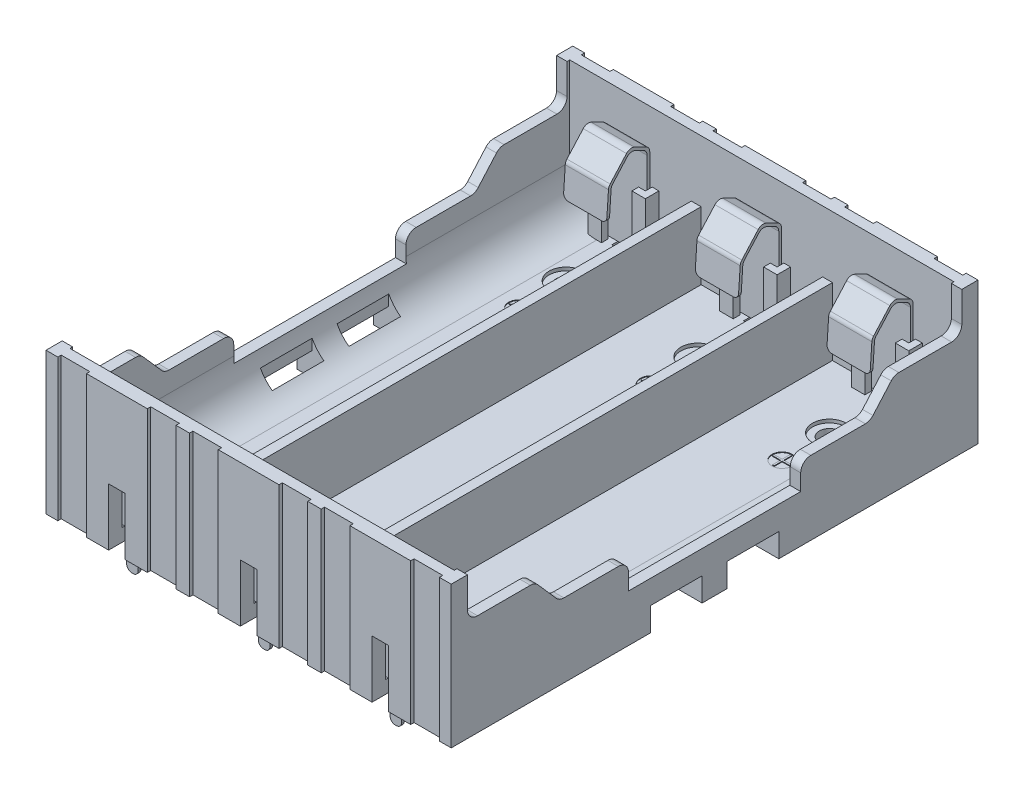
from build123d import *

# Parameters (mm, degrees)
SKETCH_1_W                      = 60
SKETCH_1_H                      = 78
EXTRUDE_5948_DEPTH              = 21
CUT_EXTRUDE_6940_DEPTH          = 54.4976635
SKETCH_3_W                      = 18
SKETCH_3_H                      = 74
CUT_EXTRUDE_7297_DEPTH          = 19.1
FILLET_1_R                      = 6
CUT_EXTRUDE_7699_DEPTH          = 15
CUT_EXTRUDE_7699_DEPTH_BACK     = 15
SKETCH_4_W                      = 74
SKETCH_4_H                      = 18.2
CUT_EXTRUDE_8242_DEPTH          = 15
FILLET_2_R                      = 1.5
FILLET_2_OF_MIRROR_2_R          = 1.5
SKETCH_6_W                      = 2.45
SKETCH_6_H                      = 7
CUT_EXTRUDE_9355_DEPTH          = 8.5
SKETCH_7_W                      = 3.4
SKETCH_7_H                      = 26.05
SKETCH_7_H_2                    = 2.75
CUT_EXTRUDE_9520_DEPTH          = 1
CUT_EXTRUDE_9_REACH             = 55.498
CUT_EXTRUDE_9_DIRECTION_2_REACH = 55.498
CUT_EXTRUDE_START               = -10.8
CUT_EXTRUDE_10_DEPTH            = 26.05
CUT_EXTRUDE_START_2             = 36.85
CUT_EXTRUDE_11_DEPTH            = 26.05
SKETCH_9_W                      = 8
SKETCH_9_H                      = 7.65
CUT_EXTRUDE_11633_DEPTH         = 3.5
SKETCH_10_W                     = 1.75
SKETCH_10_H                     = 7.65
CUT_EXTRUDE_15_DEPTH            = 54.4976635
SKETCH_11_R                     = 1.5
CUT_EXTRUDE_12484_DEPTH         = 54.4976635
EXTRUDE_START                   = -0.3
SKETCH_12_R                     = 2.8
SKETCH_12_R_2                   = 1.5
EXTRUDE_12947_DEPTH             = 0.3
CUT_EXTRUDE_START_3             = -0.5
SKETCH_13_R                     = 2.5
SKETCH_13_R_2                   = 1.5
CUT_EXTRUDE_17_DEPTH            = 0.5
SKETCH_14_R                     = 1.5
SKETCH_14_W                     = 0.25
SKETCH_14_H                     = 2.6
CUT_EXTRUDE_15586_DEPTH         = 0.1
EXTRUDE_16672_DEPTH             = 8.9
EXTRUDE_17213_DEPTH             = 3.2
SKETCH_17_W                     = 1.7
SKETCH_17_H                     = 0.4
EXTRUDE_17647_DEPTH             = 5.5
FILLET_3_R                      = 1
FILLET_4_R                      = 0.75
PATTERN_LINEAR_1_COUNT          = 3
PATTERN_LINEAR_1_PITCH          = 19.5


with BuildPart() as part:
    # Эскиз1 → Extrude 5948 (new body)
    with BuildSketch(Plane(origin=(0, 0, 0), x_dir=(1, 0, 0), z_dir=(0, 1, 0))):
        Rectangle(SKETCH_1_W, SKETCH_1_H)
    extrude(amount=EXTRUDE_5948_DEPTH)

    # Эскиз2 → Cut-Extrude 6940 (cut, through all)
    with BuildSketch(Plane(origin=(0, 0, 0), x_dir=(1, 0, 0), z_dir=(0, 1, 0))):
        Polygon((0, 49.757161848), (0, 39), (4.5, 39), (4.5, 38.5), (8.75, 38.5), (8.75, 39), (10.75, 39), (10.75, 38.5), (15, 38.5), (15, 39), (24, 39), (24, 38.5), (28.25, 38.5), (28.25, 39), (30, 39), (30, 49.757161848), align=None)
        Polygon((-4.5, 38.5), (-4.5, 39), (0, 39), (0, 49.757161848), (-30, 49.757161848), (-30, 39), (-28.25, 39), (-28.25, 38.5), (-24, 38.5), (-24, 39), (-15, 39), (-15, 38.5), (-10.75, 38.5), (-10.75, 39), (-8.75, 39), (-8.75, 38.5), align=None)
    cut_extrude_6940 = extrude(amount=CUT_EXTRUDE_6940_DEPTH, mode=Mode.SUBTRACT)

    # Зеркальное отражение1: Cut-Extrude 6940 across plane
    add(cut_extrude_6940.mirror(Plane.XY), mode=Mode.SUBTRACT)

    # Эскиз3 → Cut-Extrude 7297 (cut)
    with BuildSketch(Plane(origin=(0, 21, 0), x_dir=(1, 0, 0), z_dir=(0, 1, 0))):
        Rectangle(SKETCH_3_W, SKETCH_3_H)
        with Locations((-19.45, 0)):
            Rectangle(SKETCH_3_W, SKETCH_3_H)
        with Locations((19.45, 0)):
            Rectangle(SKETCH_3_W, SKETCH_3_H)
    extrude(amount=-CUT_EXTRUDE_7297_DEPTH, mode=Mode.SUBTRACT)

    # Скругление1
    fillet_1_edges = [part.edges().sort_by_distance(p)[0] for p in [
        (28.45, 1.9, 0),
        (-28.45, 1.9, 0),
    ]]
    fillet(fillet_1_edges, radius=FILLET_1_R)

    # Эскиз4 → Cut-Extrude 7699 (cut, two sides: drawn at the far end of the back side and taken through both)
    with BuildSketch(Plane(origin=(0, 0, 0), x_dir=(0, 0, -1), z_dir=(1, 0, 0)).offset(-CUT_EXTRUDE_7699_DEPTH_BACK)):
        with Locations((0, 21)):
            Rectangle(SKETCH_4_W, SKETCH_4_H)
    extrude(amount=CUT_EXTRUDE_7699_DEPTH + CUT_EXTRUDE_7699_DEPTH_BACK, mode=Mode.SUBTRACT)

    # Эскиз5 → Cut-Extrude 8242 (cut)
    with BuildSketch(Plane(origin=(30, 0, 0), x_dir=(0, 0, -1), z_dir=(1, 0, 0))):
        Polygon((36.6, 21), (-36.6, 21), (-36.6, 15), (-26.6, 15), (-23, 10.9), (-12.75, 10.9), (-12.75, 7), (12.75, 7), (12.75, 10.9), (23, 10.9), (26.6, 15), (36.6, 15), align=None)
    cut_extrude_8242 = extrude(amount=-CUT_EXTRUDE_8242_DEPTH, mode=Mode.SUBTRACT)

    # Скругление2
    fillet_2_edges = [part.edges().sort_by_distance(p)[0] for p in [
        (29.225, 15, -36.6),
        (29.225, 15, -26.6),
        (29.225, 10.9, -23),
        (29.225, 10.9, 12.75),
        (29.225, 10.9, 23),
        (29.225, 15, 26.6),
        (29.225, 15, 36.6),
        (29.225, 10.9, -12.75),
    ]]
    fillet(fillet_2_edges, radius=FILLET_2_R)

    # Зеркальное отражение2: Cut-Extrude 8242 across plane
    add(cut_extrude_8242.mirror(Plane(origin=(0, 0, 0), x_dir=(0, 0, 1), z_dir=(1, 0, 0))), mode=Mode.SUBTRACT)

    # Скругление2 of Зеркальное отражение2
    fillet_2_of_mirror_2_edges = [part.edges().sort_by_distance(p)[0] for p in [
        (-29.225, 15, -36.6),
        (-29.225, 15, -26.6),
        (-29.225, 10.9, -23),
        (-29.225, 10.9, 12.75),
        (-29.225, 10.9, 23),
        (-29.225, 15, 26.6),
        (-29.225, 15, 36.6),
        (-29.225, 10.9, -12.75),
    ]]
    fillet(fillet_2_of_mirror_2_edges, radius=FILLET_2_OF_MIRROR_2_R)

    # Эскиз6 → Cut-Extrude 9355 (cut)
    with BuildSketch(Plane(origin=(0, 0, 0), x_dir=(1, 0, 0), z_dir=(0, 1, 0))):
        with Locations((0, -39)):
            Rectangle(SKETCH_6_W, SKETCH_6_H)
        with Locations((-19.5, -39)):
            Rectangle(SKETCH_6_W, SKETCH_6_H)
        with Locations((19.5, -39)):
            Rectangle(SKETCH_6_W, SKETCH_6_H)
        with Locations((19.5, 39)):
            Rectangle(SKETCH_6_W, SKETCH_6_H)
        with Locations((-19.5, 39)):
            Rectangle(SKETCH_6_W, SKETCH_6_H)
        with Locations((0, 39)):
            Rectangle(SKETCH_6_W, SKETCH_6_H)
    extrude(amount=CUT_EXTRUDE_9355_DEPTH, mode=Mode.SUBTRACT)

    # Эскиз7 → Cut-Extrude 9520 (cut)
    with BuildSketch(Plane(origin=(0, 0, 0), x_dir=(1, 0, 0), z_dir=(0, 1, 0))):
        with Locations((-26.025, -23.825)):
            Rectangle(SKETCH_7_W, SKETCH_7_H)
        with Locations((-26.025, 23.825)):
            Rectangle(SKETCH_7_W, SKETCH_7_H)
        with Locations((-26.025, 0)):
            Rectangle(SKETCH_7_W, SKETCH_7_H_2)
        with Locations((26.025, 23.825)):
            Rectangle(SKETCH_7_W, SKETCH_7_H)
        with Locations((26.025, -23.825)):
            Rectangle(SKETCH_7_W, SKETCH_7_H)
        with Locations((26.025, 0)):
            Rectangle(SKETCH_7_W, SKETCH_7_H_2)
    extrude(amount=CUT_EXTRUDE_9520_DEPTH, mode=Mode.SUBTRACT)

    # Вырез-Вытянуть9: up to this face of the body (flat: up to its plane)
    cut_extrude_9_end = Plane(part.part.faces().sort_by_distance((26.025, 0.5, -1.375))[0])
    # Эскиз8 → Вырез-Вытянуть9 (cut, up to the picked face)
    with BuildSketch(Plane.XY, mode=Mode.PRIVATE) as cut_extrude_9_sk1:
        with BuildLine():
            Line((24.325, 1), (27.725, 1))
            Line((27.725, 1), (27.725, 3.072992646))
            ThreePointArc((27.725, 3.072992646), (26.172223748, 1.795028635), (24.325, 1))
        make_face()
    cut_extrude_9_tool1 = split(extrude(cut_extrude_9_sk1.sketch, amount=-CUT_EXTRUDE_9_REACH, mode=Mode.PRIVATE), bisect_by=cut_extrude_9_end, keep=Keep.BOTH, mode=Mode.PRIVATE)
    cut_extrude_9 = cut_extrude_9_tool1.solids().sort_by(Axis((26.729809, 1.623312, 0), (0, 0, -1)))[0]
    add(cut_extrude_9, mode=Mode.SUBTRACT)

    # Вырез-Вытянуть9 direction 2: up to this face of the body (flat: up to its plane)
    cut_extrude_9_direction_2_end = Plane(part.part.faces().sort_by_distance((26.025, 0.5, 1.375))[0])
    # Эскиз8 → Вырез-Вытянуть9 direction 2 (cut, up to the picked face)
    with BuildSketch(Plane.XY, mode=Mode.PRIVATE) as cut_extrude_9_direction_2_sk1:
        with BuildLine():
            Line((24.325, 1), (27.725, 1))
            Line((27.725, 1), (27.725, 3.072992646))
            ThreePointArc((27.725, 3.072992646), (26.172223748, 1.795028635), (24.325, 1))
        make_face()
    cut_extrude_9_direction_2_tool1 = split(extrude(cut_extrude_9_direction_2_sk1.sketch, amount=CUT_EXTRUDE_9_DIRECTION_2_REACH, mode=Mode.PRIVATE), bisect_by=cut_extrude_9_direction_2_end, keep=Keep.BOTH, mode=Mode.PRIVATE)
    cut_extrude_9_direction_2 = cut_extrude_9_direction_2_tool1.solids().sort_by(Axis((26.729809, 1.623312, 0), (0, 0, 1)))[0]
    add(cut_extrude_9_direction_2, mode=Mode.SUBTRACT)

    # Эскиз8<3> → Вырез-Вытянуть10 (cut)
    with BuildSketch(Plane.XY.offset(CUT_EXTRUDE_START)):
        with BuildLine():
            ThreePointArc((24.325, 1), (26.172223748, 1.795028635), (27.725, 3.072992646))
            Line((27.725, 3.072992646), (27.725, 1))
            Line((27.725, 1), (24.325, 1))
        make_face()
    cut_extrude_10 = extrude(amount=-CUT_EXTRUDE_10_DEPTH, mode=Mode.SUBTRACT)

    # Эскиз8<4> → Вырез-Вытянуть11 (cut)
    with BuildSketch(Plane.XY.offset(CUT_EXTRUDE_START_2)):
        with BuildLine():
            Line((24.325, 1), (27.725, 1))
            Line((27.725, 1), (27.725, 3.072992646))
            ThreePointArc((27.725, 3.072992646), (26.172223748, 1.795028635), (24.325, 1))
        make_face()
    cut_extrude_11 = extrude(amount=-CUT_EXTRUDE_11_DEPTH, mode=Mode.SUBTRACT)

    # Зеркальное отражение3: Вырез-Вытянуть9, Вырез-Вытянуть9 direction 2, Вырез-Вытянуть10, Вырез-Вытянуть11 across plane
    add(cut_extrude_9.mirror(Plane(origin=(0, 0, 0), x_dir=(0, 0, 1), z_dir=(1, 0, 0))), mode=Mode.SUBTRACT)
    add(cut_extrude_9_direction_2.mirror(Plane(origin=(0, 0, 0), x_dir=(0, 0, 1), z_dir=(1, 0, 0))), mode=Mode.SUBTRACT)
    add(cut_extrude_10.mirror(Plane(origin=(0, 0, 0), x_dir=(0, 0, 1), z_dir=(1, 0, 0))), mode=Mode.SUBTRACT)
    add(cut_extrude_11.mirror(Plane(origin=(0, 0, 0), x_dir=(0, 0, 1), z_dir=(1, 0, 0))), mode=Mode.SUBTRACT)

    # Эскиз9 → Cut-Extrude 11633 (cut)
    with BuildSketch(Plane(origin=(0, 0, 0), x_dir=(1, 0, 0), z_dir=(0, 1, 0))):
        with Locations((-30, -5.675)):
            Rectangle(SKETCH_9_W, SKETCH_9_H)
        with Locations((-30, 5.675)):
            Rectangle(SKETCH_9_W, SKETCH_9_H)
        with Locations((30, 5.675)):
            Rectangle(SKETCH_9_W, SKETCH_9_H)
        with Locations((30, -5.675)):
            Rectangle(SKETCH_9_W, SKETCH_9_H)
    extrude(amount=CUT_EXTRUDE_11633_DEPTH, mode=Mode.SUBTRACT)

    # Эскиз10 → Вырез-Вытянуть15 (cut, through all)
    with BuildSketch(Plane(origin=(0, 0, 0), x_dir=(1, 0, 0), z_dir=(0, 1, 0))):
        with Locations((26.875, 5.675)):
            Rectangle(SKETCH_10_W, SKETCH_10_H)
        with Locations((-26.875, -5.675)):
            Rectangle(SKETCH_10_W, SKETCH_10_H)
        with Locations((-26.875, 5.675)):
            Rectangle(SKETCH_10_W, SKETCH_10_H)
        with Locations((26.875, -5.675)):
            Rectangle(SKETCH_10_W, SKETCH_10_H)
    extrude(amount=CUT_EXTRUDE_15_DEPTH, mode=Mode.SUBTRACT)

    # Эскиз11 → Cut-Extrude 12484 (cut, through all)
    with BuildSketch(Plane(origin=(0, 0, 0), x_dir=(1, 0, 0), z_dir=(0, 1, 0))):
        with Locations(Location((-19.5, 27.5, 0), (0, 0, 90))):
            Circle(SKETCH_11_R)
        with Locations(Location((0, 27.5, 0), (0, 0, 90))):
            Circle(SKETCH_11_R)
        with Locations(Location((19.5, 27.5, 0), (0, 0, 90))):
            Circle(SKETCH_11_R)
        with Locations(Location((19.5, -27.5, 0), (0, 0, 90))):
            Circle(SKETCH_11_R)
        with Locations(Location((0, -27.5, 0), (0, 0, 90))):
            Circle(SKETCH_11_R)
        with Locations(Location((-19.5, -27.5, 0), (0, 0, 90))):
            Circle(SKETCH_11_R)
    extrude(amount=CUT_EXTRUDE_12484_DEPTH, mode=Mode.SUBTRACT)

    # Эскиз12 → Extrude 12947 (add)
    # profile 1 of 6: a face of its own
    with BuildSketch(Plane(origin=(0, 0, 0), x_dir=(1, 0, 0), z_dir=(0, 1, 0)).offset(EXTRUDE_START)):
        with Locations(Location((-19.5, 27.5, 0), (0, 0, 270))):
            Circle(SKETCH_12_R)
        with Locations(Location((-19.5, 27.5, 0), (0, 0, 90))):
            Circle(SKETCH_12_R_2, mode=Mode.SUBTRACT)
    # profile 2 of 6: a face of its own
    with BuildSketch(Plane(origin=(0, 0, 0), x_dir=(1, 0, 0), z_dir=(0, 1, 0)).offset(EXTRUDE_START)):
        with Locations(Location((0, 27.5, 0), (0, 0, 270))):
            Circle(SKETCH_12_R)
        with Locations(Location((0, 27.5, 0), (0, 0, 90))):
            Circle(SKETCH_12_R_2, mode=Mode.SUBTRACT)
    # profile 3 of 6: a face of its own
    with BuildSketch(Plane(origin=(0, 0, 0), x_dir=(1, 0, 0), z_dir=(0, 1, 0)).offset(EXTRUDE_START)):
        with Locations(Location((19.5, 27.5, 0), (0, 0, 270))):
            Circle(SKETCH_12_R)
        with Locations(Location((19.5, 27.5, 0), (0, 0, 90))):
            Circle(SKETCH_12_R_2, mode=Mode.SUBTRACT)
    # profile 4 of 6: a face of its own
    with BuildSketch(Plane(origin=(0, 0, 0), x_dir=(1, 0, 0), z_dir=(0, 1, 0)).offset(EXTRUDE_START)):
        with Locations(Location((19.5, -27.5, 0), (0, 0, 270))):
            Circle(SKETCH_12_R)
        with Locations(Location((19.5, -27.5, 0), (0, 0, 90))):
            Circle(SKETCH_12_R_2, mode=Mode.SUBTRACT)
    # profile 5 of 6: a face of its own
    with BuildSketch(Plane(origin=(0, 0, 0), x_dir=(1, 0, 0), z_dir=(0, 1, 0)).offset(EXTRUDE_START)):
        with Locations(Location((0, -27.5, 0), (0, 0, 270))):
            Circle(SKETCH_12_R)
        with Locations(Location((0, -27.5, 0), (0, 0, 90))):
            Circle(SKETCH_12_R_2, mode=Mode.SUBTRACT)
    # profile 6 of 6: a face of its own
    with BuildSketch(Plane(origin=(0, 0, 0), x_dir=(1, 0, 0), z_dir=(0, 1, 0)).offset(EXTRUDE_START)):
        with Locations(Location((-19.5, -27.5, 0), (0, 0, 270))):
            Circle(SKETCH_12_R)
        with Locations(Location((-19.5, -27.5, 0), (0, 0, 90))):
            Circle(SKETCH_12_R_2, mode=Mode.SUBTRACT)
    extrude(amount=EXTRUDE_12947_DEPTH)

    # Эскиз13 → Вырез-Вытянуть17 (cut)
    # profile 1 of 6: a face of its own
    with BuildSketch(Plane(origin=(0, 1.9, 0), x_dir=(1, 0, 0), z_dir=(0, 1, 0)).offset(CUT_EXTRUDE_START_3)):
        with Locations(Location((-19.5, -27.5, 0), (0, 0, 270))):
            Circle(SKETCH_13_R)
        with Locations(Location((-19.5, -27.5, 0), (0, 0, 90))):
            Circle(SKETCH_13_R_2, mode=Mode.SUBTRACT)
    # profile 2 of 6: a face of its own
    with BuildSketch(Plane(origin=(0, 1.9, 0), x_dir=(1, 0, 0), z_dir=(0, 1, 0)).offset(CUT_EXTRUDE_START_3)):
        with Locations(Location((0, -27.5, 0), (0, 0, 270))):
            Circle(SKETCH_13_R)
        with Locations(Location((0, -27.5, 0), (0, 0, 90))):
            Circle(SKETCH_13_R_2, mode=Mode.SUBTRACT)
    # profile 3 of 6: a face of its own
    with BuildSketch(Plane(origin=(0, 1.9, 0), x_dir=(1, 0, 0), z_dir=(0, 1, 0)).offset(CUT_EXTRUDE_START_3)):
        with Locations(Location((19.5, 27.5, 0), (0, 0, 270))):
            Circle(SKETCH_13_R)
        with Locations(Location((19.5, 27.5, 0), (0, 0, 90))):
            Circle(SKETCH_13_R_2, mode=Mode.SUBTRACT)
    # profile 4 of 6: a face of its own
    with BuildSketch(Plane(origin=(0, 1.9, 0), x_dir=(1, 0, 0), z_dir=(0, 1, 0)).offset(CUT_EXTRUDE_START_3)):
        with Locations(Location((0, 27.5, 0), (0, 0, 270))):
            Circle(SKETCH_13_R)
        with Locations(Location((0, 27.5, 0), (0, 0, 90))):
            Circle(SKETCH_13_R_2, mode=Mode.SUBTRACT)
    # profile 5 of 6: a face of its own
    with BuildSketch(Plane(origin=(0, 1.9, 0), x_dir=(1, 0, 0), z_dir=(0, 1, 0)).offset(CUT_EXTRUDE_START_3)):
        with Locations(Location((-19.5, 27.5, 0), (0, 0, 270))):
            Circle(SKETCH_13_R)
        with Locations(Location((-19.5, 27.5, 0), (0, 0, 90))):
            Circle(SKETCH_13_R_2, mode=Mode.SUBTRACT)
    # profile 6 of 6: a face of its own
    with BuildSketch(Plane(origin=(0, 1.9, 0), x_dir=(1, 0, 0), z_dir=(0, 1, 0)).offset(CUT_EXTRUDE_START_3)):
        with Locations(Location((19.5, -27.5, 0), (0, 0, 270))):
            Circle(SKETCH_13_R)
        with Locations(Location((19.5, -27.5, 0), (0, 0, 90))):
            Circle(SKETCH_13_R_2, mode=Mode.SUBTRACT)
    extrude(amount=CUT_EXTRUDE_17_DEPTH, mode=Mode.SUBTRACT)

    # Эскиз14 → Cut-Extrude 15586 (cut)
    # profile 1 of 6: a face of its own
    with BuildSketch(Plane(origin=(0, 1.9, 0), x_dir=(1, 0, 0), z_dir=(0, 1, 0))):
        with Locations(Location((-19.5, 20.5, 0), (0, 0, 270))):
            Circle(SKETCH_14_R)
        Polygon((-19.625, 21.8), (-19.375, 21.8), (-19.375, 20.625), (-18.2, 20.625), (-18.2, 20.375), (-19.375, 20.375), (-19.375, 19.2), (-19.625, 19.2), (-19.625, 20.375), (-20.8, 20.375), (-20.8, 20.625), (-19.625, 20.625), align=None, mode=Mode.SUBTRACT)
    # profile 2 of 6: a face of its own
    with BuildSketch(Plane(origin=(0, 1.9, 0), x_dir=(1, 0, 0), z_dir=(0, 1, 0))):
        with Locations(Location((-19.5, -20.5, 0), (0, 0, 270))):
            Circle(SKETCH_14_R)
        with Locations((-19.5, -20.5)):
            Rectangle(SKETCH_14_W, SKETCH_14_H, mode=Mode.SUBTRACT)
    # profile 3 of 6: a face of its own
    with BuildSketch(Plane(origin=(0, 1.9, 0), x_dir=(1, 0, 0), z_dir=(0, 1, 0))):
        with Locations(Location((0, 20.5, 0), (0, 0, 270))):
            Circle(SKETCH_14_R)
        Polygon((-0.125, 21.8), (0.125, 21.8), (0.125, 20.625), (1.3, 20.625), (1.3, 20.375), (0.125, 20.375), (0.125, 19.2), (-0.125, 19.2), (-0.125, 20.375), (-1.3, 20.375), (-1.3, 20.625), (-0.125, 20.625), align=None, mode=Mode.SUBTRACT)
    # profile 4 of 6: a face of its own
    with BuildSketch(Plane(origin=(0, 1.9, 0), x_dir=(1, 0, 0), z_dir=(0, 1, 0))):
        with Locations(Location((0, -20.5, 0), (0, 0, 270))):
            Circle(SKETCH_14_R)
        with Locations((0, -20.5)):
            Rectangle(SKETCH_14_W, SKETCH_14_H, mode=Mode.SUBTRACT)
    # profile 5 of 6: a face of its own
    with BuildSketch(Plane(origin=(0, 1.9, 0), x_dir=(1, 0, 0), z_dir=(0, 1, 0))):
        with Locations(Location((19.5, 20.5, 0), (0, 0, 270))):
            Circle(SKETCH_14_R)
        Polygon((19.375, 21.8), (19.625, 21.8), (19.625, 20.625), (20.8, 20.625), (20.8, 20.375), (19.625, 20.375), (19.625, 19.2), (19.375, 19.2), (19.375, 20.375), (18.2, 20.375), (18.2, 20.625), (19.375, 20.625), align=None, mode=Mode.SUBTRACT)
    # profile 6 of 6: a face of its own
    with BuildSketch(Plane(origin=(0, 1.9, 0), x_dir=(1, 0, 0), z_dir=(0, 1, 0))):
        with Locations(Location((19.5, -20.5, 0), (0, 0, 270))):
            Circle(SKETCH_14_R)
        with Locations((19.5, -20.5)):
            Rectangle(SKETCH_14_W, SKETCH_14_H, mode=Mode.SUBTRACT)
    extrude(amount=-CUT_EXTRUDE_15586_DEPTH, mode=Mode.SUBTRACT)

    # Эскиз15 → Extrude 16672 (add)
    with BuildSketch(Plane(origin=(0, 1.9, 0), x_dir=(1, 0, 0), z_dir=(0, 1, 0))):
        Polygon((-21.75, 35), (-23.75, 35), (-23.75, 37), (-22.75, 37), (-22.75, 36), (-21.75, 36), align=None)
        Polygon((-17.25, 35), (-17.25, 36), (-16.25, 36), (-16.25, 37), (-15.25, 37), (-15.25, 35), align=None)
        Polygon((-2.25, 35), (-4.25, 35), (-4.25, 37), (-3.25, 37), (-3.25, 36), (-2.25, 36), align=None)
        Polygon((2.25, 35), (2.25, 36), (3.25, 36), (3.25, 37), (4.25, 37), (4.25, 35), align=None)
        Polygon((17.25, 35), (15.25, 35), (15.25, 37), (16.25, 37), (16.25, 36), (17.25, 36), align=None)
        Polygon((21.75, 35), (21.75, 36), (22.75, 36), (22.75, 37), (23.75, 37), (23.75, 35), align=None)
        Polygon((23.75, -35), (21.75, -35), (21.75, -36), (22.75, -36), (22.75, -37), (23.75, -37), align=None)
        Polygon((17.25, -36), (17.25, -35), (15.25, -35), (15.25, -37), (16.25, -37), (16.25, -36), align=None)
        Polygon((4.25, -35), (2.25, -35), (2.25, -36), (3.25, -36), (3.25, -37), (4.25, -37), align=None)
        Polygon((-2.25, -36), (-2.25, -35), (-4.25, -35), (-4.25, -37), (-3.25, -37), (-3.25, -36), align=None)
        Polygon((-15.25, -35), (-17.25, -35), (-17.25, -36), (-16.25, -36), (-16.25, -37), (-15.25, -37), align=None)
        Polygon((-21.75, -36), (-21.75, -35), (-23.75, -35), (-23.75, -37), (-22.75, -37), (-22.75, -36), align=None)
    extrude(amount=EXTRUDE_16672_DEPTH)


with BuildPart() as body_2:
    # Эскиз16 → Extrude 17213 (new, symmetric)
    with BuildSketch(Plane.ZY.offset(19.5)):
        Polygon((-36.3, 2), (-36.3, 15.826972516), (-33.848539634, 17.01426896), (-30.994965619, 13.823876222), (-30.699555061, 9.402575836), (-30.300444939, 9.429242503), (-30.605034381, 13.987919845), (-33.751460366, 17.50573104), (-36.7, 16.077688118), (-36.7, 2), align=None)
    extrude(amount=EXTRUDE_17213_DEPTH, both=True)

    # Эскиз17 → Extrude 17647 (add)
    with BuildSketch(Plane.XZ.offset(-2)):
        with Locations((-19.5, -36.5)):
            Rectangle(SKETCH_17_W, SKETCH_17_H)
    extrude(amount=EXTRUDE_17647_DEPTH)

    # Скругление3
    fillet_3_edges = [body_2.edges().sort_by_distance(p)[0] for p in [
        (-19.5, 13.823876222, -30.994965619),
        (-19.5, 17.01426896, -33.848539634),
        (-19.5, 15.826972516, -36.3),
        (-19.5, 16.077688118, -36.7),
        (-19.5, 17.50573104, -33.751460366),
        (-19.5, 13.987919845, -30.605034381),
    ]]
    fillet(fillet_3_edges, radius=FILLET_3_R)

    # Скругление4
    fillet_4_edges = [body_2.edges().sort_by_distance(p)[0] for p in [
        (-16.3, 9.41590917, -30.5),
        (-22.7, 2, -36.5),
        (-20.35, -3.5, -36.5),
        (-18.65, -3.5, -36.5),
        (-22.7, 9.41590917, -30.5),
        (-16.3, 2, -36.5),
    ]]
    fillet(fillet_4_edges, radius=FILLET_4_R)


with BuildPart() as pattern_linear_1_1:
    # Линейный массив1: pattern copy
    add(body_2.part.moved(Location(Vector(1, 0, 0) * (1 * PATTERN_LINEAR_1_PITCH))))


with BuildPart() as pattern_linear_1_2:
    # Линейный массив1: pattern copy
    add(body_2.part.moved(Location(Vector(1, 0, 0) * (2 * PATTERN_LINEAR_1_PITCH))))


with BuildPart() as body_5:
    # Зеркальное отражение4: mirrored copy
    add(pattern_linear_1_2.part.mirror(Plane.XY))


with BuildPart() as body_6:
    # Mirror 4 2: mirrored copy
    add(pattern_linear_1_1.part.mirror(Plane.XY))


with BuildPart() as body_7:
    # Mirror 4 3: mirrored copy
    add(body_2.part.mirror(Plane.XY))


solid = Compound([part.part, body_2.part, pattern_linear_1_1.part, pattern_linear_1_2.part, body_5.part, body_6.part, body_7.part])
